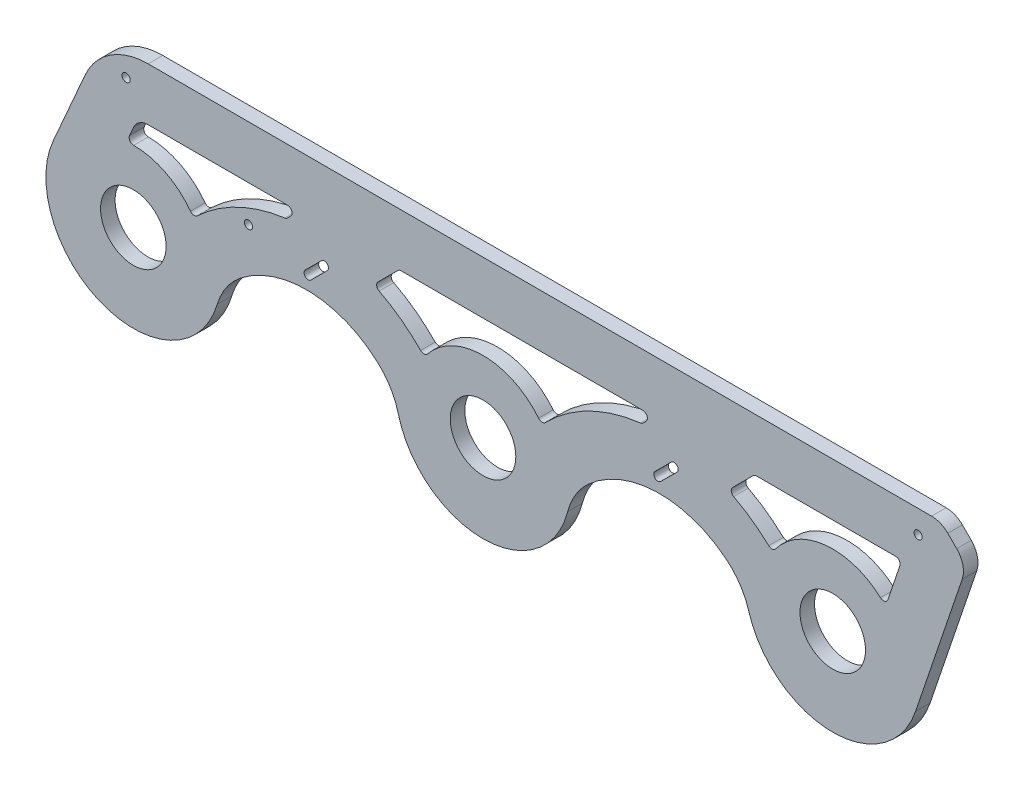
from build123d import *
from build123d.topology import SkipClean

# Parameters (mm, degrees)
SKETCH1_R           = 14.2875
BOSS_EXTRUDE1_DEPTH = 6.35
FILLET1_R           = 10
FILLET2_R           = 20
SKETCH2_R           = 1.778
CUT_EXTRUDE1_DEPTH  = 6.35
FILLET4_R           = 28.4734
BOSS_EXTRUDE2_DEPTH = 6.35
FILLET7_R           = 30
CUT_EXTRUDE4_DEPTH  = 6.35
FILLET9_DEPTH       = 6.35
SKETCH6_R           = 1.778
CUT_EXTRUDE5_DEPTH  = 10
CHAMFER1_SIZE       = 15
CHAMFER1_SIZE2      = 11.830755168
FILLET11_R          = 10
BOSS_EXTRUDE3_DEPTH = 6.35
SKETCH8_R           = 1.778
BOSS_EXTRUDE4_DEPTH = 6.35
CUT_EXTRUDE6_DEPTH  = 10
FILLET12_R          = 10
FILLET13_R          = 10
FILLET14_R          = 10
FILLET15_R          = 10
FILLET16_R          = 10
CUT_EXTRUDE7_DEPTH  = 10
BOSS_EXTRUDE5_START = -6.35
SKETCH10_R          = 1.778
BOSS_EXTRUDE5_DEPTH = 6.35
FILLET17_R          = 30
BOSS_EXTRUDE6_START = -6.35
BOSS_EXTRUDE6_DEPTH = 6.35


with BuildPart() as part:
    # Sketch1 → Boss-Extrude1 (new body)
    with BuildSketch(Plane.XY):
        with BuildLine():
            Line((76.2, 30), (19.765397885, -21.612188753))
            ThreePointArc((19.765397885, -21.612188753), (-7.664310495, -28.266871084), (-27.975511048, -8.66766623))
            Line((-27.975511048, -8.66766623), (-30.661018302, 0))
            Line((-30.661018302, 0), (-10.522036605, 65))
            Line((-10.522036605, 65), (355.6, 65))
            Line((355.6, 65), (332.775511048, -8.66766623))
            ThreePointArc((332.775511048, -8.66766623), (312.464310495, -28.266871084), (285.034602115, -21.612188753))
            Line((285.034602115, -21.612188753), (228.6, 30))
            Line((228.6, 30), (172.803916322, -24.185422532))
            ThreePointArc((172.803916322, -24.185422532), (152.4, -32.637001398), (131.996083678, -24.185422532))
            Line((131.996083678, -24.185422532), (76.2, 30))
        make_face()
        Circle(SKETCH1_R, mode=Mode.SUBTRACT)
        with Locations((152.4, -3.175)):
            Circle(SKETCH1_R, mode=Mode.SUBTRACT)
        with Locations((304.8, 0)):
            Circle(SKETCH1_R, mode=Mode.SUBTRACT)
    extrude(amount=BOSS_EXTRUDE1_DEPTH)

    # Fillet1
    fillet1_edges = [part.edges().sort_by_distance(p)[0] for p in [
        (-10.522036605, 65, 3.175),
        (355.6, 65, 3.175),
    ]]
    fillet(fillet1_edges, radius=FILLET1_R)

    # Fillet2
    fillet2_edges = [part.edges().sort_by_distance(p)[0] for p in [
        (228.6, 30, 3.175),
        (76.2, 30, 3.175),
    ]]
    fillet(fillet2_edges, radius=FILLET2_R)

    # Sketch2 → Cut-Extrude1 (cut)
    with BuildSketch(Plane(origin=(0, 0, 0), x_dir=(-1, 0, 0), z_dir=(0, 0, -1))):
        with Locations((-229.01165953, 23.51851186)):
            Circle(SKETCH2_R)
        with Locations((-342.03271747, 55)):
            Circle(SKETCH2_R)
        with Locations((-76.34605429, 23.51851186)):
            Circle(SKETCH2_R)
        with Locations(Location((3.151363828, 55, 0), (0, 0, 180))):
            Circle(SKETCH2_R)
    extrude(amount=-CUT_EXTRUDE1_DEPTH, mode=Mode.SUBTRACT)

    # Fillet4
    fillet4_edges = [part.edges().sort_by_distance(p)[0] for p in [
        (-30.661018302, 0, 3.175),
    ]]
    fillet(fillet4_edges, radius=FILLET4_R)

    # Sketch4 → Boss-Extrude2 (add)
    with BuildSketch(Plane.XY.offset(6.35)):
        with BuildLine():
            ThreePointArc((-12.703394916, 57.95951045), (-9.084528898, 63.04969268), (-3.151363828, 65))
            Line((-3.151363828, 65), (-13.151363828, 65))
            Line((-13.151363828, 65), (-34.906140988, 15.269948308))
            ThreePointArc((-34.906140988, 15.269948308), (-10.316360553, -36.676732474), (37.748130536, -5.166105019))
            Line((37.748130536, -5.166105019), (19.765397885, -21.612188753))
            ThreePointArc((19.765397885, -21.612188753), (-7.664310495, -28.266871084), (-27.975511048, -8.66766623))
            Line((-27.975511048, -8.66766623), (-28.050159667, -8.426732485))
            ThreePointArc((-28.050159667, -8.426732485), (-29.325679471, 0), (-28.050159667, 8.426732485))
            Line((-28.050159667, 8.426732485), (-12.703394916, 57.95951045))
        make_face()
        with BuildLine():
            Line((367.03271747, 65), (342.03271747, 65))
            ThreePointArc((342.03271747, 65), (350.08241015, 60.93316507), (351.584748558, 52.04048955))
            Line((351.584748558, 52.04048955), (332.775511048, -8.66766623))
            ThreePointArc((332.775511048, -8.66766623), (312.464310495, -28.266871084), (285.034602115, -21.612188753))
            Line((285.034602115, -21.612188753), (267.051869464, -5.166105019))
            ThreePointArc((267.051869464, -5.166105019), (301.177259665, -37.927374711), (340.887568868, -12.218730424))
            Line((340.887568868, -12.218730424), (367.03271747, 65))
        make_face()
        with BuildLine():
            Line((62.290842982, 17.279399331), (60.592342389, 15.72603792))
            Line((60.592342389, 15.72603792), (68.130864542, 20.996768873))
            ThreePointArc((68.130864542, 20.996768873), (65.048790473, 19.392687011), (62.290842982, 17.279399331))
        make_face()
        with BuildLine():
            ThreePointArc((74.888341467, 22.500495492), (71.444046197, 22.043232685), (68.130864542, 20.996768873))
            Line((68.130864542, 20.996768873), (105.753753933, 1.29937195))
            Line((105.753753933, 1.29937195), (89.721872743, 16.868462091))
            ThreePointArc((89.721872743, 16.868462091), (84.206374965, 20.662880592), (77.747671619, 22.424549857))
            ThreePointArc((77.747671619, 22.424549857), (76.393262458, 25.295885031), (74.888341467, 22.500495492))
        make_face()
        with BuildLine():
            Line((220.832871891, 20.771986703), (256.207126926, 4.751939547))
            Line((256.207126926, 4.751939547), (242.509157018, 17.279399331))
            ThreePointArc((242.509157018, 17.279399331), (236.916143222, 20.892449631), (230.446997722, 22.469184326))
            ThreePointArc((230.446997722, 22.469184326), (229.01165953, 25.29651186), (227.576321337, 22.469184326))
            ThreePointArc((227.576321337, 22.469184326), (224.130268968, 21.915910418), (220.832871891, 20.771986703))
        make_face()
        with BuildLine():
            Line((211.556759647, 13.448745522), (220.832871891, 20.771986703))
            ThreePointArc((220.832871891, 20.771986703), (217.784547298, 19.072249628), (215.078127257, 16.868462091))
            Line((215.078127257, 16.868462091), (211.556759647, 13.448745522))
        make_face()
        with BuildLine():
            Line((131.996083678, -24.185422532), (114.514059271, -7.208050345))
            ThreePointArc((114.514059271, -7.208050345), (152.4, -41.275), (190.285940729, -7.208050345))
            Line((190.285940729, -7.208050345), (172.803916322, -24.185422532))
            ThreePointArc((172.803916322, -24.185422532), (152.4, -32.637001398), (131.996083678, -24.185422532))
        make_face()
    extrude(amount=-BOSS_EXTRUDE2_DEPTH)

    # Fillet7
    # the kernel refuses this fillet: 30 mm, written as the material it adds along each edge
    with BuildSketch(Plane(origin=(220.832871891, 20.771986703, 6.35), x_dir=(-0.7848829847834699, -0.6196440108621978, 0), z_dir=(0, 0, -1))) as fillet7_piece_1:
        with BuildLine():
            CenterArc((18.669895515, -29.207154991), FILLET7_R, 103.201773783, 49.45286053)
            Line((-7.977718615, -15.426564975), (0, 0))
            Line((0, 0), (11.818465203, 0))
        make_face()
    extrude(amount=6.35)
    with BuildSketch(Plane(origin=(68.130864542, 20.996768873, 6.35), x_dir=(-0.819550218760279, -0.5730073637659283, 0), z_dir=(0, 0, -1))) as fillet7_piece_2:
        with BuildLine():
            CenterArc((19.112116789, -28.314616862), FILLET7_R, 109.296600171, 43.297831689)
            Line((-7.521002941, -14.506034983), (0, 0))
            Line((0, 0), (9.198365128, 0))
        make_face()
    extrude(amount=6.35)
    # the kernel refuses this fillet: 30 mm, written as the material it takes off along each edge
    with BuildSketch(Plane(origin=(-13.151363828, 65, 55.403084312), x_dir=(-0.4007860448353176, -0.9161716794713002, 0), z_dir=(0, 0, -1))) as fillet7_2_piece_1:
        with BuildLine():
            CenterArc((FILLET7_R * 0.65404112416, -FILLET7_R), FILLET7_R, 90, 66.372672864)
            Line((-FILLET7_R * 0.262130555312, -FILLET7_R * 0.599213955165), (0, 0))
            Line((0, 0), (FILLET7_R * 0.65404112416, 0))
        make_face()
    extrude(amount=104.456168624, mode=Mode.SUBTRACT)

    # Sketch5 → Cut-Extrude4 (cut)
    with BuildSketch(Plane.XY.offset(6.35)):
        with BuildLine():
            ThreePointArc((202.727550006, 25.783673337), (222.609463156, 31.248183301), (242.841525508, 27.271376461))
            Line((242.841525508, 27.271376461), (264.569178734, 17.431507638))
            Line((264.569178734, 17.431507638), (281.763141289, 1.706792524))
            ThreePointArc((281.763141289, 1.706792524), (305.653980027, 23.084209281), (327.9, 0))
            ThreePointArc((327.9, 0), (327.592925131, -3.754006392), (326.679864589, -7.408206635))
            Line((326.679864589, -7.408206635), (346.117455511, 50))
            Line((346.117455511, 50), (6.469869897, 50))
            ThreePointArc((6.469869897, 50), (-1.740585021, 47.553423041), (-7.272705295, 41.011790673))
            Line((-7.272705295, 41.011790673), (-21.163565796, 9.258157636))
            ThreePointArc((-21.163565796, 9.258157636), (3.890126649, 22.770088156), (23.036858711, 1.706792524))
            Line((23.036858711, 1.706792524), (52.825875761, 28.950297628))
            ThreePointArc((52.825875761, 28.950297628), (71.4348738, 31.756464685), (89.564149012, 26.706834809))
            Line((89.564149012, 26.706834809), (114.641099784, 13.577841769))
            Line((114.641099784, 13.577841769), (129.424605527, -0.77890968))
            ThreePointArc((129.424605527, -0.77890968), (152.4, 19.925), (175.375394473, -0.77890968))
            Line((175.375394473, -0.77890968), (202.727550006, 25.783673337))
        make_face()
    extrude(amount=-CUT_EXTRUDE4_DEPTH, mode=Mode.SUBTRACT)

    # Fillet9: read off the stored shape, not the designer's step
    # Fillet9 outline → Fillet9 (add)
    with BuildSketch(Plane.XY):
        with BuildLine():
            Line((346.117455511, 50), (332.173947538, 50))
            ThreePointArc((332.173947538, 50), (340.300144637, 45.827943094), (341.64575039, 36.792984141))
            Line((341.64575039, 36.792984141), (346.117455511, 50))
        make_face()
        with BuildLine():
            Line((326.679864589, -7.408206635), (336.428348814, 21.383581349))
            ThreePointArc((336.428348814, 21.383581349), (329.483593888, 14.915162915), (320.262725429, 17.161413762))
            ThreePointArc((320.262725429, 17.161413762), (327.150253218, 5.837480712), (326.679864589, -7.408206635))
        make_face()
        with BuildLine():
            ThreePointArc((0.126311649, 23.099654659), (-8.202890478, 27.648769951), (-8.980724779, 37.107365609))
            Line((-8.980724779, 37.107365609), (-21.163565796, 9.258157636))
            ThreePointArc((-21.163565796, 9.258157636), (-12.591198333, 19.366768562), (0.126311649, 23.099654659))
        make_face()
    extrude(amount=FILLET9_DEPTH)

    # Sketch6 → Cut-Extrude5 (cut)
    with BuildSketch(Plane.XY.offset(6.35)):
        with Locations((76.2, 20.164023691)):
            Circle(SKETCH6_R)
        with Locations((228.6, 20.32759964)):
            Circle(SKETCH6_R)
    extrude(amount=-CUT_EXTRUDE5_DEPTH, mode=Mode.SUBTRACT)

    # Chamfer1
    chamfer1_edges = [part.edges().sort_by_distance(p)[0] for p in [
        (367.03271747, 65, 3.175),
    ]]
    chamfer1_side = [part.faces().sort_by_distance(p)[0] for p in [
        (186.751293683, 65, 3.175),
    ]]
    chamfer(chamfer1_edges, length=CHAMFER1_SIZE, length2=CHAMFER1_SIZE2, reference=chamfer1_side[0])

    # Fillet11
    fillet11_edges = [part.edges().sort_by_distance(p)[0] for p in [
        (363.238575525, 53.794141945, 3.175),
        (352.03271747, 65, 3.175),
    ]]
    fillet(fillet11_edges, radius=FILLET11_R)

    # Sketch7 → Boss-Extrude3 (add)
    with BuildSketch(Plane.XY.offset(6.35)):
        Polygon((100.225182041, 58.888519513), (69.228437645, 27.891775117), (86.023226415, 23.473360451), (115.72256861, 53.172702646), align=None)
        Polygon((224.083172996, 27.891775117), (239.038298252, 21.633696938), (270.57730396, 53.172702646), (247.971808558, 51.78041068), align=None)
    extrude(amount=-BOSS_EXTRUDE3_DEPTH)

    # Sketch8 → Boss-Extrude4 (add)
    # profile 1 of 8: a face of its own
    with BuildSketch(Plane.XY.offset(6.35)):
        with BuildLine():
            Line((42.965540082, 19.932541018), (26.540335697, 4.910892646))
            ThreePointArc((26.540335697, 4.910892646), (26.03493106, 4.232890698), (25.538925832, 3.547982455))
            Line((25.538925832, 3.547982455), (37.748130536, -5.166105019))
            ThreePointArc((37.748130536, -5.166105019), (44.188663643, 2.104358832), (52.003991477, 7.871573252))
            Line((52.003991477, 7.871573252), (60.592342389, 15.72603792))
            ThreePointArc((60.592342389, 15.72603792), (71.406290885, 16.717093686), (81.86459706, 13.793481951))
            ThreePointArc((81.86459706, 13.793481951), (100.496139451, 6.878937362), (114.514059271, -7.208050345))
            Line((114.514059271, -7.208050345), (127.169254419, 0.844653286))
            ThreePointArc((127.169254419, 0.844653286), (126.658671717, 1.633641021), (126.136055565, 2.414709969))
            Line((126.136055565, 2.414709969), (114.641099784, 13.577841769))
            Line((114.641099784, 13.577841769), (89.564149012, 26.706834809))
            ThreePointArc((89.564149012, 26.706834809), (89.463102992, 26.759574333), (89.361923711, 26.812057747))
            Line((89.361923711, 26.812057747), (90.030119482, 27.480253519))
            ThreePointArc((90.030119482, 27.480253519), (80.261374749, 29.051255746), (70.367134521, 29.030471993))
            ThreePointArc((70.367134521, 29.030471993), (56.12315118, 26.117501091), (42.965540082, 19.932541018))
        make_face()
        with Locations((76.2, 20.164023691)):
            Circle(SKETCH8_R, mode=Mode.SUBTRACT)
    # profile 2 of 8: a face of its own
    with BuildSketch(Plane.XY.offset(6.35)):
        with BuildLine():
            ThreePointArc((126.136055565, 2.414709969), (110.406465662, 18.294217169), (90.030119482, 27.480253519))
            Line((90.030119482, 27.480253519), (89.361923711, 26.812057747))
            ThreePointArc((89.361923711, 26.812057747), (89.463102992, 26.759574333), (89.564149012, 26.706834809))
            Line((89.564149012, 26.706834809), (114.641099784, 13.577841769))
            Line((114.641099784, 13.577841769), (126.136055565, 2.414709969))
        make_face()
    # profile 3 of 8: a face of its own
    with BuildSketch(Plane.XY.offset(6.35)):
        with BuildLine():
            Line((60.592342389, 15.72603792), (52.003991477, 7.871573252))
            ThreePointArc((52.003991477, 7.871573252), (66.43379909, 13.356222223), (81.86459706, 13.793481951))
            ThreePointArc((81.86459706, 13.793481951), (71.406290885, 16.717093686), (60.592342389, 15.72603792))
        make_face()
    # profile 4 of 8: a face of its own
    with BuildSketch(Plane.XY.offset(6.35)):
        with BuildLine():
            Line((196.372099466, 19.611685086), (178.663944435, 2.414709969))
            ThreePointArc((178.663944435, 2.414709969), (178.141328283, 1.633641021), (177.630745581, 0.844653286))
            Line((177.630745581, 0.844653286), (190.285940729, -7.208050345))
            ThreePointArc((190.285940729, -7.208050345), (197.093762385, 1.152818304), (205.650401581, 7.712885828))
            Line((205.650401581, 7.712885828), (211.556759647, 13.448745522))
            ThreePointArc((211.556759647, 13.448745522), (223.983698914, 16.277662761), (236.463614039, 13.692452762))
            ThreePointArc((236.463614039, 13.692452762), (253.661443339, 7.350945008), (267.051869464, -5.166105019))
            Line((267.051869464, -5.166105019), (279.261074168, 3.547982455))
            ThreePointArc((279.261074168, 3.547982455), (278.76506894, 4.232890698), (278.259664303, 4.910892646))
            Line((278.259664303, 4.910892646), (264.569178734, 17.431507638))
            Line((264.569178734, 17.431507638), (244.104163185, 26.699561871))
            Line((244.104163185, 26.699561871), (244.695857174, 27.29125586))
            ThreePointArc((244.695857174, 27.29125586), (235.069370607, 28.974257477), (225.297764534, 29.106366656))
            ThreePointArc((225.297764534, 29.106366656), (210.236231282, 26.182975027), (196.372099466, 19.611685086))
        make_face()
        with Locations((228.6, 20.32759964)):
            Circle(SKETCH8_R, mode=Mode.SUBTRACT)
    # profile 5 of 8: a face of its own
    with BuildSketch(Plane.XY.offset(6.35)):
        with BuildLine():
            Line((211.556759647, 13.448745522), (205.650401581, 7.712885828))
            ThreePointArc((205.650401581, 7.712885828), (220.5349661, 13.392794234), (236.463614039, 13.692452762))
            ThreePointArc((236.463614039, 13.692452762), (223.983698914, 16.277662761), (211.556759647, 13.448745522))
        make_face()
    # profile 6 of 8: a face of its own
    with BuildSketch(Plane.XY.offset(6.35)):
        with BuildLine():
            ThreePointArc((278.259664303, 4.910892646), (263.371186182, 18.940642396), (244.695857174, 27.29125586))
            Line((244.695857174, 27.29125586), (244.104163185, 26.699561871))
            Line((244.104163185, 26.699561871), (264.569178734, 17.431507638))
            Line((264.569178734, 17.431507638), (278.259664303, 4.910892646))
        make_face()
    # profile 7 of 8: a face of its own
    with BuildSketch(Plane.XY.offset(6.35)):
        with BuildLine():
            ThreePointArc((196.372099466, 19.611685086), (186.64361318, 11.913598089), (178.663944435, 2.414709969))
            Line((178.663944435, 2.414709969), (196.372099466, 19.611685086))
        make_face()
    # profile 8 of 8: a face of its own
    with BuildSketch(Plane.XY.offset(6.35)):
        with BuildLine():
            ThreePointArc((42.965540082, 19.932541018), (34.065540526, 13.173341548), (26.540335697, 4.910892646))
            Line((26.540335697, 4.910892646), (42.965540082, 19.932541018))
        make_face()
    extrude(amount=-BOSS_EXTRUDE4_DEPTH)

    # Sketch8<3> → Cut-Extrude6 (cut)
    with SkipClean():  # the faces are left unmerged after this step: merging them gives an invalid solid
        with BuildSketch(Plane.XY.offset(6.35)):
            with BuildLine():
                Line((26.540335697, 4.910892646), (23.036858711, 1.706792524))
                ThreePointArc((23.036858711, 1.706792524), (23.086771831, 0.781643421), (23.099546395, -0.144763074))
                ThreePointArc((23.099546395, -0.144763074), (24.756867192, 2.425991729), (26.540335697, 4.910892646))
            make_face()
            with BuildLine():
                Line((52.825875761, 28.950297628), (42.965540082, 19.932541018))
                ThreePointArc((42.965540082, 19.932541018), (56.12315118, 26.117501091), (70.367134521, 29.030471993))
                Line((70.367134521, 29.030471993), (72.972728384, 31.636065856))
                ThreePointArc((72.972728384, 31.636065856), (62.745683135, 31.445529161), (52.825875761, 28.950297628))
            make_face()
            with BuildLine():
                ThreePointArc((52.003991477, 7.871573252), (44.188663643, 2.104358832), (37.748130536, -5.166105019))
                Line((37.748130536, -5.166105019), (52.003991477, 7.871573252))
            make_face()
            with BuildLine():
                Line((105.753753933, 1.29937195), (114.514059271, -7.208050345))
                ThreePointArc((114.514059271, -7.208050345), (100.496139451, 6.878937362), (81.86459706, 13.793481951))
                ThreePointArc((81.86459706, 13.793481951), (82.236984648, 13.608280674), (82.606769012, 13.417934797))
                Line((82.606769012, 13.417934797), (105.753753933, 1.29937195))
            make_face()
            with BuildLine():
                ThreePointArc((126.136055565, 2.414709969), (127.78416506, -0.142246527), (129.303415047, -2.777805464))
                ThreePointArc((129.303415047, -2.777805464), (129.342339274, -1.777043687), (129.424605527, -0.77890968))
                Line((129.424605527, -0.77890968), (126.136055565, 2.414709969))
            make_face()
            with BuildLine():
                ThreePointArc((205.650401581, 7.712885828), (197.093762385, 1.152818304), (190.285940729, -7.208050345))
                Line((190.285940729, -7.208050345), (205.650401581, 7.712885828))
            make_face()
            with BuildLine():
                Line((256.207126926, 4.751939547), (267.051869464, -5.166105019))
                ThreePointArc((267.051869464, -5.166105019), (253.661443339, 7.350945008), (236.463614039, 13.692452762))
                ThreePointArc((236.463614039, 13.692452762), (236.558593891, 13.65003287), (236.653426084, 13.6072839))
                Line((236.653426084, 13.6072839), (256.207126926, 4.751939547))
            make_face()
            with BuildLine():
                ThreePointArc((175.496584953, -2.777805464), (177.01583494, -0.142246527), (178.663944435, 2.414709969))
                Line((178.663944435, 2.414709969), (175.375394473, -0.77890968))
                ThreePointArc((175.375394473, -0.77890968), (175.457660726, -1.777043687), (175.496584953, -2.777805464))
            make_face()
            with BuildLine():
                ThreePointArc((278.259664303, 4.910892646), (280.043132809, 2.425991728), (281.700453605, -0.144763074))
                ThreePointArc((281.700453605, -0.144763074), (281.713228169, 0.781643421), (281.763141289, 1.706792524))
                Line((281.763141289, 1.706792524), (278.259664303, 4.910892646))
            make_face()
            with BuildLine():
                Line((225.297764534, 29.106366656), (227.364470932, 31.173073053))
                ThreePointArc((227.364470932, 31.173073053), (214.660742934, 30.239572268), (202.727550006, 25.783673337))
                Line((202.727550006, 25.783673337), (196.372099466, 19.611685086))
                ThreePointArc((196.372099466, 19.611685086), (210.236231282, 26.182975027), (225.297764534, 29.106366656))
            make_face()
        extrude(amount=-CUT_EXTRUDE6_DEPTH, mode=Mode.SUBTRACT)

    # Fillet12
    fillet12_edges = [part.edges().sort_by_distance(p)[0] for p in [
        (23.099546395, -0.144763074, 3.175),
    ]]
    fillet(fillet12_edges, radius=FILLET12_R)

    # Fillet13
    fillet13_edges = [part.edges().sort_by_distance(p)[0] for p in [
        (129.303415047, -2.777805464, 3.175),
        (175.496584953, -2.777805464, 3.175),
        (281.700453605, -0.144763074, 3.175),
    ]]
    fillet(fillet13_edges, radius=FILLET13_R)

    # Fillet14
    fillet14_edges = [part.edges().sort_by_distance(p)[0] for p in [
        (225.297764534, 29.106366656, 3.175),
        (70.367134521, 29.030471993, 3.175),
    ]]
    fillet(fillet14_edges, radius=FILLET14_R)

    # Fillet15
    fillet15_edges = [part.edges().sort_by_distance(p)[0] for p in [
        (267.404601314, 50, 3.175),
        (91.336662528, 50, 3.175),
        (112.549865964, 50, 3.175),
        (244.695857174, 27.29125586, 3.175),
        (90.030119482, 27.480253519, 3.175),
    ]]
    fillet(fillet15_edges, radius=FILLET15_R)

    # Fillet16
    fillet16_edges = [part.edges().sort_by_distance(p)[0] for p in [
        (246.191397879, 50, 3.175),
    ]]
    fillet(fillet16_edges, radius=FILLET16_R)

    # Sketch9 → Cut-Extrude7 (cut)
    with SkipClean():  # the faces are left unmerged after this step: merging them gives an invalid solid
        with BuildSketch(Plane.XY.offset(6.35)):
            with BuildLine():
                Line((74.942764143, 21.421259548), (82.013831955, 28.49232736))
                ThreePointArc((82.013831955, 28.49232736), (84.528303669, 28.49232736), (84.528303669, 25.977855646))
                Line((84.528303669, 25.977855646), (77.457235857, 18.906787834))
                ThreePointArc((77.457235857, 18.906787834), (74.942764143, 18.906787834), (74.942764143, 21.421259548))
            make_face()
            with BuildLine():
                Line((227.342764143, 21.584835497), (234.413831955, 28.655903309))
                ThreePointArc((234.413831955, 28.655903309), (236.928303669, 28.655903309), (236.928303669, 26.141431595))
                Line((236.928303669, 26.141431595), (229.857235857, 19.070363783))
                ThreePointArc((229.857235857, 19.070363783), (227.342764143, 19.070363783), (227.342764143, 21.584835497))
            make_face()
        extrude(amount=-CUT_EXTRUDE7_DEPTH, mode=Mode.SUBTRACT)

    # Sketch10 → Boss-Extrude5 (add)
    # profile 1 of 3: a face of its own
    with SkipClean():  # the faces are left unmerged after this step: merging them gives an invalid solid
        with BuildSketch(Plane(origin=(0, 0, 0), x_dir=(-1, 0, 0), z_dir=(0, 0, -1)).offset(BOSS_EXTRUDE5_START)):
            with BuildLine():
                ThreePointArc((-67.194526904, 50), (-76.433322229, 43.826834324), (-74.265594716, 32.928932188))
                Line((-74.265594716, 32.928932188), (-72.848479306, 31.511816778))
                ThreePointArc((-72.848479306, 31.511816778), (-70.222953971, 29.625365286), (-67.132776867, 28.675161103))
                ThreePointArc((-67.132776867, 28.675161103), (-54.584312682, 25.583776849), (-42.962627059, 19.930721632))
                ThreePointArc((-42.962627059, 19.930721632), (-41.828685193, 19.205024398), (-40.71095078, 18.45460424))
                ThreePointArc((-40.71095078, 18.45460424), (-36.930649094, 15.635886475), (-33.378159261, 12.534972634))
                ThreePointArc((-33.378159261, 12.534972634), (-25.652977382, 9.847596586), (-18.506028464, 13.825227321))
                ThreePointArc((-18.506028464, 13.825227321), (-10.406477556, 20.623172037), (-0.126311649, 23.099654659))
                ThreePointArc((-0.126311649, 23.099654659), (8.202890478, 27.648769951), (8.980724779, 37.107365609))
                Line((8.980724779, 37.107365609), (7.272705295, 41.011790673))
                ThreePointArc((7.272705295, 41.011790673), (1.740585021, 47.553423041), (-6.469869897, 50))
                Line((-6.469869897, 50), (-67.194526904, 50))
            make_face()
            with Locations((-50.2, 26.164023691)):
                Circle(SKETCH10_R, mode=Mode.SUBTRACT)
            with BuildLine():
                Line((-69.3129454, 35.047350684), (-70.73006081, 36.464466094))
                ThreePointArc((-70.73006081, 36.464466094), (-71.813924567, 41.913417162), (-67.194526904, 45))
                Line((-67.194526904, 45), (-6.469869897, 45))
                ThreePointArc((-6.469869897, 45), (-0.996233285, 43.368948694), (2.691846898, 39.007860448))
                Line((2.691846898, 39.007860448), (4.399866381, 35.103435385))
                ThreePointArc((4.399866381, 35.103435385), (4.010949231, 30.374137556), (-0.153651832, 28.09957991))
                ThreePointArc((-0.153651832, 28.09957991), (-12.658961876, 25.087062088), (-22.511662331, 16.817700767))
                ThreePointArc((-22.511662331, 16.817700767), (-26.08513679, 14.8288854), (-29.947727729, 16.172573424))
                ThreePointArc((-29.947727729, 16.172573424), (-46.837281896, 27.753655452), (-66.455094181, 33.629022846))
                ThreePointArc((-66.455094181, 33.629022846), (-68.000182733, 34.104124938), (-69.3129454, 35.047350684))
            make_face(mode=Mode.SUBTRACT)
        # profile 2 of 3: a face of its own
        with BuildSketch(Plane(origin=(0, 0, 0), x_dir=(-1, 0, 0), z_dir=(0, 0, -1)).offset(BOSS_EXTRUDE5_START)):
            with BuildLine():
                ThreePointArc((-222.049262255, 50), (-231.28805758, 43.826834324), (-229.120330067, 32.928932188))
                Line((-229.120330067, 32.928932188), (-227.84247345, 31.651075572))
                ThreePointArc((-227.84247345, 31.651075572), (-225.148473717, 29.730965761), (-221.975427684, 28.794891452))
                ThreePointArc((-221.975427684, 28.794891452), (-202.106159082, 22.851738113), (-185.354998338, 10.624411336))
                ThreePointArc((-185.354998338, 10.624411336), (-177.7169483, 7.598630206), (-170.390122667, 11.315185866))
                ThreePointArc((-170.390122667, 11.315185866), (-152.4, 19.925), (-134.409877333, 11.315185866))
                ThreePointArc((-134.409877333, 11.315185866), (-127.0830517, 7.598630206), (-119.445001662, 10.624411336))
                ThreePointArc((-119.445001662, 10.624411336), (-111.941546557, 17.193098502), (-103.47246446, 22.458470097))
                ThreePointArc((-103.47246446, 22.458470097), (-98.164563741, 29.805562574), (-100.973163037, 38.423297073))
                Line((-100.973163037, 38.423297073), (-109.620933775, 47.071067812))
                ThreePointArc((-109.620933775, 47.071067812), (-112.865167264, 49.238795325), (-116.692001587, 50))
                Line((-116.692001587, 50), (-222.049262255, 50))
            make_face()
            with BuildLine():
                Line((-222.049262255, 45), (-116.692001587, 45))
                ThreePointArc((-116.692001587, 45), (-114.778584426, 44.619397663), (-113.156467681, 43.535533906))
                Line((-113.156467681, 43.535533906), (-104.508696943, 34.887763168))
                ThreePointArc((-104.508696943, 34.887763168), (-103.104397295, 30.578895918), (-105.758347654, 26.905349679))
                ThreePointArc((-105.758347654, 26.905349679), (-114.918098395, 21.210577706), (-123.033473552, 14.106202468))
                ThreePointArc((-123.033473552, 14.106202468), (-126.852498572, 12.593311904), (-130.515911388, 14.451589733))
                ThreePointArc((-130.515911388, 14.451589733), (-152.4, 24.925), (-174.284088612, 14.451589733))
                ThreePointArc((-174.284088612, 14.451589733), (-177.947501428, 12.593311904), (-181.766526448, 14.106202468))
                ThreePointArc((-181.766526448, 14.106202468), (-199.883774016, 27.330689399), (-221.373416661, 33.758517418))
                ThreePointArc((-221.373416661, 33.758517418), (-222.959939678, 34.226554572), (-224.306939544, 35.186609478))
                Line((-224.306939544, 35.186609478), (-225.584796161, 36.464466094))
                ThreePointArc((-225.584796161, 36.464466094), (-226.668659917, 41.913417162), (-222.049262255, 45))
            make_face(mode=Mode.SUBTRACT)
        # profile 3 of 3: a face of its own
        with BuildSketch(Plane(origin=(0, 0, 0), x_dir=(-1, 0, 0), z_dir=(0, 0, -1)).offset(BOSS_EXTRUDE5_START)):
            with BuildLine():
                ThreePointArc((-257.918824258, 22.181909427), (-252.690189928, 29.532193538), (-255.506229694, 38.10162838))
                Line((-255.506229694, 38.10162838), (-264.475669126, 47.071067812))
                ThreePointArc((-264.475669126, 47.071067812), (-267.719902614, 49.238795325), (-271.546736938, 50))
                Line((-271.546736938, 50), (-332.173947538, 50))
                ThreePointArc((-332.173947538, 50), (-340.300144637, 45.827943094), (-341.64575039, 36.792984141))
                Line((-341.64575039, 36.792984141), (-336.428348814, 21.383581349))
                ThreePointArc((-336.428348814, 21.383581349), (-329.483593889, 14.915162915), (-320.262725429, 17.161413762))
                ThreePointArc((-320.262725429, 17.161413762), (-302.54213412, 22.989389763), (-286.293971536, 13.825227321))
                ThreePointArc((-286.293971536, 13.825227321), (-279.147022618, 9.847596586), (-271.421840739, 12.534972634))
                ThreePointArc((-271.421840739, 12.534972634), (-264.998233798, 17.817411245), (-257.918824258, 22.181909427))
            make_face()
            with BuildLine():
                Line((-268.011203032, 43.535533906), (-259.0417636, 34.566094474))
                ThreePointArc((-259.0417636, 34.566094474), (-257.633743717, 30.281377053), (-260.248060882, 26.606234998))
                ThreePointArc((-260.248060882, 26.606234998), (-267.904808807, 21.885804259), (-274.852272271, 16.172573424))
                ThreePointArc((-274.852272271, 16.172573424), (-278.71486321, 14.8288854), (-282.288337669, 16.817700767))
                ThreePointArc((-282.288337669, 16.817700767), (-302.053418561, 27.965448153), (-323.609635695, 20.876005485))
                ThreePointArc((-323.609635695, 20.876005485), (-328.220069925, 19.752880062), (-331.692447387, 22.987089279))
                Line((-331.692447387, 22.987089279), (-336.909848964, 38.39649207))
                ThreePointArc((-336.909848964, 38.39649207), (-336.237046087, 42.913971547), (-332.173947538, 45))
                Line((-332.173947538, 45), (-271.546736938, 45))
                ThreePointArc((-271.546736938, 45), (-269.633319776, 44.619397663), (-268.011203032, 43.535533906))
            make_face(mode=Mode.SUBTRACT)
        extrude(amount=BOSS_EXTRUDE5_DEPTH)

    # Fillet17
    fillet17_edges = [part.edges().sort_by_distance(p)[0] for p in [
        (190.285940729, -7.208050345, 3.175),
        (267.051869464, -5.166105019, 3.175),
        (114.514059271, -7.208050345, 3.175),
        (37.748130536, -5.166105019, 3.175),
    ]]
    fillet(fillet17_edges, radius=FILLET17_R)

    # Sketch11 → Boss-Extrude6 (add)
    # profile 1 of 3: a face of its own
    with SkipClean():  # the faces are left unmerged after this step: merging them gives an invalid solid
        with BuildSketch(Plane(origin=(0, 0, 0), x_dir=(-1, 0, 0), z_dir=(0, 0, -1)).offset(BOSS_EXTRUDE6_START)):
            with BuildLine():
                ThreePointArc((2.691846898, 39.007860448), (-0.996233285, 43.368948694), (-6.469869897, 45))
                Line((-6.469869897, 45), (-67.194526904, 45))
                ThreePointArc((-67.194526904, 45), (-71.813924567, 41.913417162), (-70.73006081, 36.464466094))
                Line((-70.73006081, 36.464466094), (-69.3129454, 35.047350684))
                ThreePointArc((-69.3129454, 35.047350684), (-68.000182733, 34.104124938), (-66.455094181, 33.629022846))
                ThreePointArc((-66.455094181, 33.629022846), (-46.837281896, 27.753655452), (-29.947727729, 16.172573424))
                ThreePointArc((-29.947727729, 16.172573424), (-26.08513679, 14.8288854), (-22.511662331, 16.817700767))
                ThreePointArc((-22.511662331, 16.817700767), (-12.658961876, 25.087062088), (-0.153651832, 28.09957991))
                ThreePointArc((-0.153651832, 28.09957991), (4.010949231, 30.374137556), (4.399866381, 35.103435385))
                Line((4.399866381, 35.103435385), (2.691846898, 39.007860448))
            make_face()
            with BuildLine():
                Line((-67.194526904, 42), (-6.469869897, 42))
                ThreePointArc((-6.469869897, 42), (-2.638324268, 40.858264086), (-0.05666814, 37.805502314))
                Line((-0.05666814, 37.805502314), (1.651351343, 33.90107725))
                ThreePointArc((1.651351343, 33.90107725), (1.495784483, 32.009358119), (-0.170055943, 31.09953506))
                ThreePointArc((-0.170055943, 31.09953506), (-14.010452468, 27.765396119), (-24.915042651, 18.613184835))
                ThreePointArc((-24.915042651, 18.613184835), (-26.344432434, 17.817658688), (-27.88946881, 18.355133898))
                ThreePointArc((-27.88946881, 18.355133898), (-45.543132337, 30.460161857), (-66.048484569, 36.601339893))
                ThreePointArc((-66.048484569, 36.601339893), (-66.66651999, 36.791380729), (-67.191625057, 37.168671028))
                Line((-67.191625057, 37.168671028), (-68.608740467, 38.585786438))
                ThreePointArc((-68.608740467, 38.585786438), (-69.042285969, 40.765366865), (-67.194526904, 42))
            make_face(mode=Mode.SUBTRACT)
        # profile 2 of 3: a face of its own
        with BuildSketch(Plane(origin=(0, 0, 0), x_dir=(-1, 0, 0), z_dir=(0, 0, -1)).offset(BOSS_EXTRUDE6_START)):
            with BuildLine():
                ThreePointArc((-105.758347654, 26.905349679), (-103.104397295, 30.578895918), (-104.508696943, 34.887763168))
                Line((-104.508696943, 34.887763168), (-113.156467681, 43.535533906))
                ThreePointArc((-113.156467681, 43.535533906), (-114.778584426, 44.619397663), (-116.692001587, 45))
                Line((-116.692001587, 45), (-222.049262255, 45))
                ThreePointArc((-222.049262255, 45), (-226.668659917, 41.913417162), (-225.584796161, 36.464466094))
                Line((-225.584796161, 36.464466094), (-224.306939544, 35.186609478))
                ThreePointArc((-224.306939544, 35.186609478), (-222.959939678, 34.226554572), (-221.373416661, 33.758517418))
                ThreePointArc((-221.373416661, 33.758517418), (-199.883774016, 27.330689399), (-181.766526448, 14.106202468))
                ThreePointArc((-181.766526448, 14.106202468), (-177.947501428, 12.593311904), (-174.284088612, 14.451589733))
                ThreePointArc((-174.284088612, 14.451589733), (-152.4, 24.925), (-130.515911388, 14.451589733))
                ThreePointArc((-130.515911388, 14.451589733), (-126.852498572, 12.593311904), (-123.033473552, 14.106202468))
                ThreePointArc((-123.033473552, 14.106202468), (-114.918098395, 21.210577706), (-105.758347654, 26.905349679))
            make_face()
            with BuildLine():
                Line((-115.277788025, 41.414213562), (-106.630017287, 32.766442824))
                ThreePointArc((-106.630017287, 32.766442824), (-106.068297427, 31.042895924), (-107.129877571, 29.573477429))
                ThreePointArc((-107.129877571, 29.573477429), (-116.704029498, 23.621065228), (-125.186556687, 16.195277148))
                ThreePointArc((-125.186556687, 16.195277148), (-126.714166694, 15.590120922), (-128.179531821, 16.333432054))
                ThreePointArc((-128.179531821, 16.333432054), (-152.4, 27.925), (-176.620468179, 16.333432054))
                ThreePointArc((-176.620468179, 16.333432054), (-178.085833306, 15.590120922), (-179.613443313, 16.195277148))
                ThreePointArc((-179.613443313, 16.195277148), (-198.550342977, 30.01806017), (-221.012210047, 36.736692997))
                ThreePointArc((-221.012210047, 36.736692997), (-221.646819254, 36.923907859), (-222.185619201, 37.307929821))
                Line((-222.185619201, 37.307929821), (-223.463475817, 38.585786438))
                ThreePointArc((-223.463475817, 38.585786438), (-223.89702132, 40.765366865), (-222.049262255, 42))
                Line((-222.049262255, 42), (-116.692001587, 42))
                ThreePointArc((-116.692001587, 42), (-115.926634723, 41.847759065), (-115.277788025, 41.414213562))
            make_face(mode=Mode.SUBTRACT)
        # profile 3 of 3: a face of its own
        with BuildSketch(Plane(origin=(0, 0, 0), x_dir=(-1, 0, 0), z_dir=(0, 0, -1)).offset(BOSS_EXTRUDE6_START)):
            with BuildLine():
                ThreePointArc((-332.173947538, 45), (-336.237046087, 42.913971547), (-336.909848964, 38.39649207))
                Line((-336.909848964, 38.39649207), (-331.692447387, 22.987089279))
                ThreePointArc((-331.692447387, 22.987089279), (-328.220069925, 19.752880062), (-323.609635695, 20.876005485))
                ThreePointArc((-323.609635695, 20.876005485), (-302.053418561, 27.965448153), (-282.288337669, 16.817700767))
                ThreePointArc((-282.288337669, 16.817700767), (-278.71486321, 14.8288854), (-274.852272271, 16.172573424))
                ThreePointArc((-274.852272271, 16.172573424), (-267.904808807, 21.885804259), (-260.248060882, 26.606234998))
                ThreePointArc((-260.248060882, 26.606234998), (-257.633743717, 30.281377053), (-259.0417636, 34.566094474))
                Line((-259.0417636, 34.566094474), (-268.011203032, 43.535533906))
                ThreePointArc((-268.011203032, 43.535533906), (-269.633319776, 44.619397663), (-271.546736938, 45))
                Line((-271.546736938, 45), (-332.173947538, 45))
            make_face()
            with BuildLine():
                Line((-328.850906532, 23.949194037), (-334.068308108, 39.358596828))
                ThreePointArc((-334.068308108, 39.358596828), (-333.799186957, 41.165588619), (-332.173947538, 42))
                Line((-332.173947538, 42), (-271.546736938, 42))
                ThreePointArc((-271.546736938, 42), (-270.781370073, 41.847759065), (-270.132523375, 41.414213562))
                Line((-270.132523375, 41.414213562), (-261.163083943, 32.44477413))
                ThreePointArc((-261.163083943, 32.44477413), (-260.59987599, 30.730887162), (-261.645602856, 29.26083034))
                ThreePointArc((-261.645602856, 29.26083034), (-269.648753813, 24.326840067), (-276.91053119, 18.355133898))
                ThreePointArc((-276.91053119, 18.355133898), (-278.455567566, 17.817658688), (-279.884957349, 18.613184835))
                ThreePointArc((-279.884957349, 18.613184835), (-301.760189226, 30.951083187), (-325.617781855, 23.104760519))
                ThreePointArc((-325.617781855, 23.104760519), (-327.461955547, 22.65551035), (-328.850906532, 23.949194037))
            make_face(mode=Mode.SUBTRACT)
        extrude(amount=BOSS_EXTRUDE6_DEPTH)


solid = part.part
